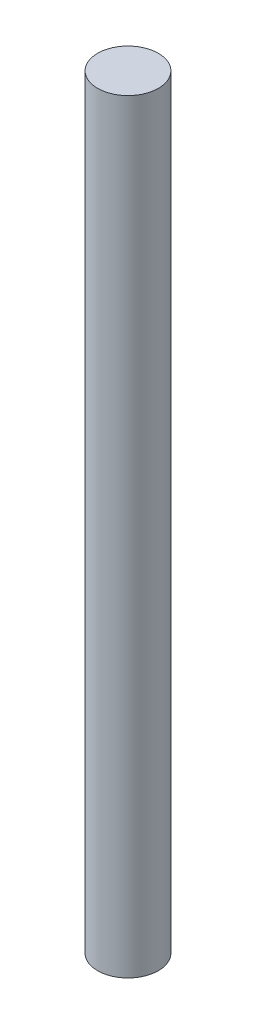
from build123d import *

# Parameters (mm, degrees)
SKETCH_1_R      = 2.5
EXTRUDE_1_DEPTH = 62.9


with BuildPart() as part:
    # 草图1 → 凸台-拉伸1 (new body)
    with BuildSketch(Plane(origin=(0, 0, 0), x_dir=(1, 0, 0), z_dir=(0, 1, 0))):
        with Locations((0, -0.456480485)):
            Circle(SKETCH_1_R)
    extrude(amount=EXTRUDE_1_DEPTH)


solid = part.part
